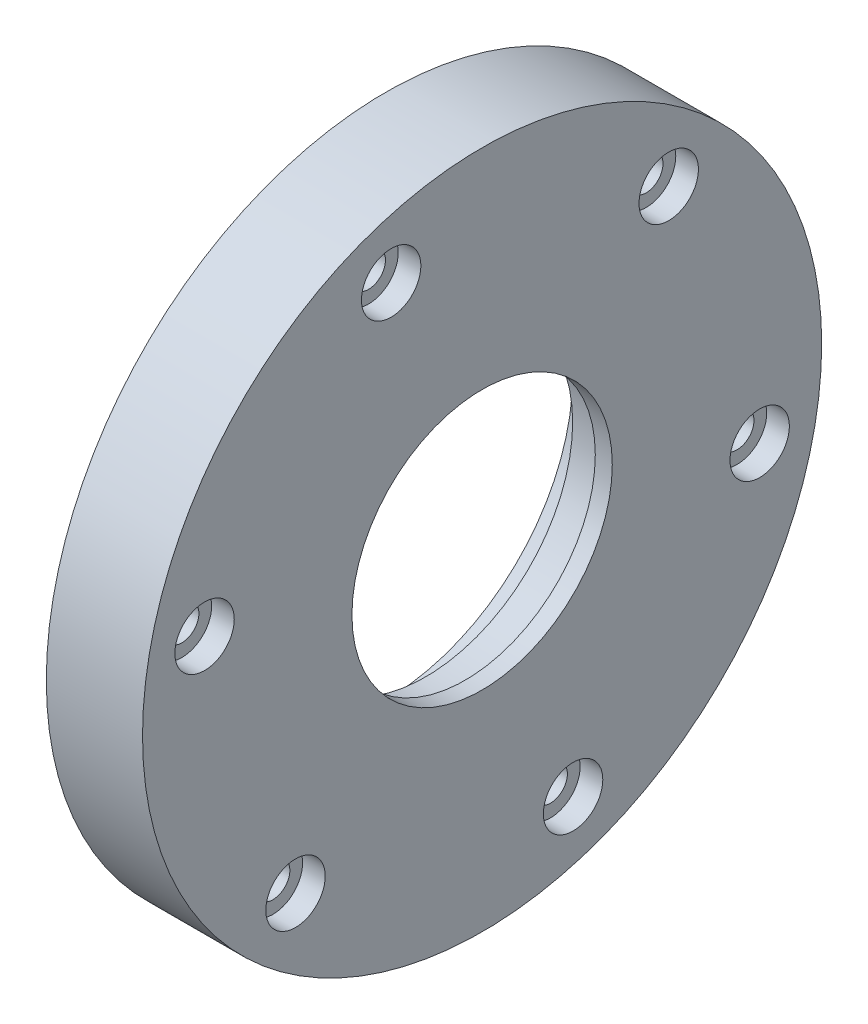
from build123d import *

# Parameters (mm, degrees)
SKETCH2_R          = 2.5
CUT_EXTRUDE1_DEPTH = 4
SKETCH3_R          = 3
CUT_EXTRUDE4_DEPTH = 87.539008545
SKETCH4_R          = 5.25
CUT_EXTRUDE5_DEPTH = 4


with BuildPart() as part:
    # Sketch1 → Revolve1 (revolve)
    with BuildSketch(Plane.XY):
        Polygon((0, 60), (0, 33), (7, 33), (7, 26), (14, 26), (14, 23), (17, 23), (17, 60), align=None)
    revolve(axis=Axis((0, 0, 0), (1, 0, 0)))

    # Sketch2 → Cut-Extrude1 (cut)
    with BuildSketch(Plane.ZY):
        with Locations((0, 40)):
            Circle(SKETCH2_R)
        with Locations((15.307337295, 36.9551813)):
            Circle(SKETCH2_R)
        with Locations((28.284271247, 28.284271247)):
            Circle(SKETCH2_R)
        with Locations((36.9551813, 15.307337295)):
            Circle(SKETCH2_R)
        with Locations((40, 0)):
            Circle(SKETCH2_R)
        with Locations((36.9551813, -15.307337295)):
            Circle(SKETCH2_R)
        with Locations((28.284271247, -28.284271247)):
            Circle(SKETCH2_R)
        with Locations((15.307337295, -36.9551813)):
            Circle(SKETCH2_R)
        with Locations((0, -40)):
            Circle(SKETCH2_R)
        with Locations((-15.307337295, -36.9551813)):
            Circle(SKETCH2_R)
        with Locations((-28.284271247, -28.284271247)):
            Circle(SKETCH2_R)
        with Locations((-36.9551813, -15.307337295)):
            Circle(SKETCH2_R)
        with Locations((-40, 0)):
            Circle(SKETCH2_R)
        with Locations((-36.9551813, 15.307337295)):
            Circle(SKETCH2_R)
        with Locations((-28.284271247, 28.284271247)):
            Circle(SKETCH2_R)
        with Locations((-15.307337295, 36.9551813)):
            Circle(SKETCH2_R)
    extrude(amount=-CUT_EXTRUDE1_DEPTH, mode=Mode.SUBTRACT)

    # Sketch3 → Cut-Extrude4 (cut, through all)
    with BuildSketch(Plane(origin=(17, 0, 0), x_dir=(0, 0, -1), z_dir=(1, 0, 0))):
        with Locations((49.03926402, -9.754516101)):
            Circle(SKETCH3_R)
        with Locations((16.071973265, -47.346506475)):
            Circle(SKETCH3_R)
        with Locations((-32.967290755, -37.591990374)):
            Circle(SKETCH3_R)
        with Locations((-49.03926402, 9.754516101)):
            Circle(SKETCH3_R)
        with Locations((-16.071973265, 47.346506475)):
            Circle(SKETCH3_R)
        with Locations((32.967290755, 37.591990374)):
            Circle(SKETCH3_R)
    extrude(amount=-CUT_EXTRUDE4_DEPTH, mode=Mode.SUBTRACT)

    # Sketch4 → Cut-Extrude5 (cut)
    with BuildSketch(Plane(origin=(17, 0, 0), x_dir=(0, 0, -1), z_dir=(1, 0, 0))):
        with Locations((32.967290755, 37.591990374)):
            Circle(SKETCH4_R)
        with Locations((49.03926402, -9.754516101)):
            Circle(SKETCH4_R)
        with Locations((16.071973265, -47.346506475)):
            Circle(SKETCH4_R)
        with Locations((-32.967290755, -37.591990374)):
            Circle(SKETCH4_R)
        with Locations((-49.03926402, 9.754516101)):
            Circle(SKETCH4_R)
        with Locations((-16.071973265, 47.346506475)):
            Circle(SKETCH4_R)
    extrude(amount=-CUT_EXTRUDE5_DEPTH, mode=Mode.SUBTRACT)


solid = part.part
